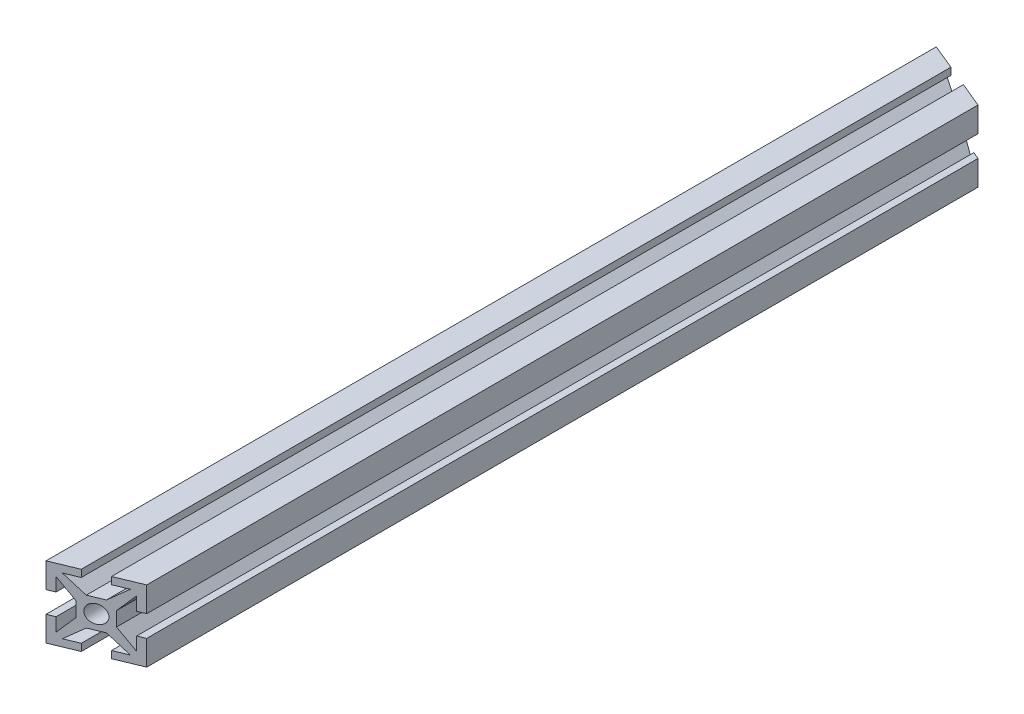
from build123d import *

# Parameters (mm, degrees)
ESQUISSE2_R             = 1.25
BOSS_EXTRU_1_DEPTH      = 125
ENL_V_MAT_EXTRU_1_DEPTH = 126.49900398


with BuildPart() as part:
    # Esquisse2 → Boss.-Extru.1 (new body)
    with BuildSketch(Plane.XY):
        Polygon((-1, -2), (1, -2), (3.383507185, -4), (1.5, -4), (1.5, -5), (5, -5), (5, -1.5), (4, -1.5), (4, -3.383507185), (2, -1), (2, 1), (4, 3.383507185), (4, 1.5), (5, 1.5), (5, 5), (1.5, 5), (1.5, 4), (3.383507185, 4), (1, 2), (-1, 2), (-3.383507185, 4), (-1.5, 4), (-1.5, 5), (-5, 5), (-5, 1.5), (-4, 1.5), (-4, 3.383507185), (-2, 1), (-2, -1), (-4, -3.383507185), (-4, -1.5), (-5, -1.5), (-5, -5), (-1.5, -5), (-1.5, -4), (-3.383507185, -4), align=None)
        Circle(ESQUISSE2_R, mode=Mode.SUBTRACT)
    extrude(amount=BOSS_EXTRU_1_DEPTH)

    # Esquisse3 → Enlèv. mat.-Extru.1 (cut, through all)
    with BuildSketch(Plane(origin=(0, 5, 0), x_dir=(1, 0, 0), z_dir=(0, 1, 0))):
        Polygon((-5, 0), (5, 0), (5, -4.142135624), align=None)
        Polygon((5, -120.857864376), (-5, -125), (5, -125), align=None)
    extrude(amount=-ENL_V_MAT_EXTRU_1_DEPTH, mode=Mode.SUBTRACT)


solid = part.part
